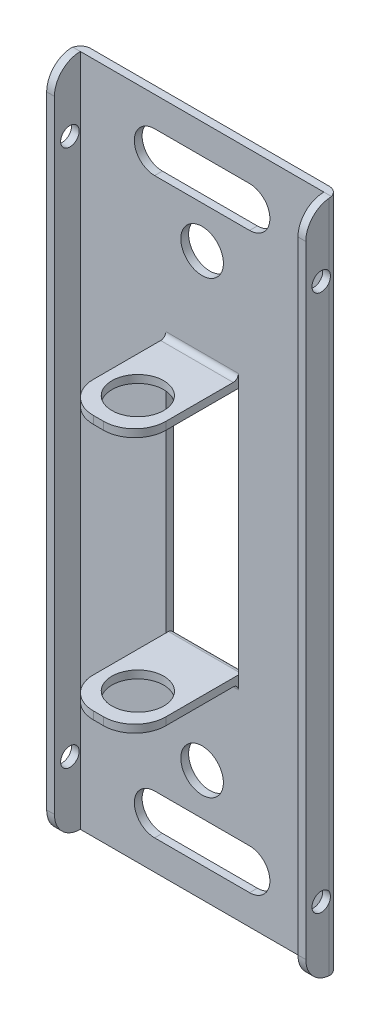
from build123d import *

# Parameters (mm, degrees)
SKETCH1_W           = 50
SKETCH1_H           = 130
SKETCH1_R           = 4.108488497
SKETCH1_W_2         = 14
SKETCH1_H_2         = 47.88
BOSS_EXTRUDE1_DEPTH = 1.5
SKETCH2_W           = 1.5
SKETCH2_H           = 130
BOSS_EXTRUDE2_DEPTH = 5
SKETCH3_R           = 1.78890387
CUT_EXTRUDE1_DEPTH  = 83.263296798
FILLET1_R           = 5
FILLET2_R           = 2
SKETCH4_W           = 14
SKETCH4_H           = 1.5
BOSS_EXTRUDE3_DEPTH = 20
FILLET3_R           = 6
FILLET4_R           = 1
SKETCH5_R           = 5
CUT_EXTRUDE2_DEPTH  = 97.263407498


with BuildPart() as part:
    # Sketch1 → Boss-Extrude1 (new body)
    with BuildSketch(Plane.XY):
        Rectangle(SKETCH1_W, SKETCH1_H)
        with Locations((0, 43.4034135)):
            Circle(SKETCH1_R, mode=Mode.SUBTRACT)
        with Locations(Location((0, -43.4034135, 0), (0, 0, 180))):
            Circle(SKETCH1_R, mode=Mode.SUBTRACT)
        Rectangle(SKETCH1_W_2, SKETCH1_H_2, mode=Mode.SUBTRACT)
        with BuildLine():
            Line((9.165030278, 51.424748184), (-9.165030278, 51.424748184))
            ThreePointArc((-9.165030278, 51.424748184), (-13.077876466, 55.337594372), (-9.165030278, 59.250440559))
            Line((-9.165030278, 59.250440559), (9.165030278, 59.250440559))
            ThreePointArc((9.165030278, 59.250440559), (13.077876466, 55.337594372), (9.165030278, 51.424748184))
        make_face(mode=Mode.SUBTRACT)
        with BuildLine():
            Line((9.165030278, -51.424748184), (-9.165030278, -51.424748184))
            ThreePointArc((-9.165030278, -51.424748184), (-13.077876466, -55.337594372), (-9.165030278, -59.250440559))
            Line((-9.165030278, -59.250440559), (9.165030278, -59.250440559))
            ThreePointArc((9.165030278, -59.250440559), (13.077876466, -55.337594372), (9.165030278, -51.424748184))
        make_face(mode=Mode.SUBTRACT)
    extrude(amount=BOSS_EXTRUDE1_DEPTH)

    # Sketch2 → Boss-Extrude2 (add)
    with BuildSketch(Plane.XY.offset(1.5)):
        with Locations((-24.25, 0)):
            Rectangle(SKETCH2_W, SKETCH2_H)
        with Locations((24.25, 0)):
            Rectangle(SKETCH2_W, SKETCH2_H)
    extrude(amount=BOSS_EXTRUDE2_DEPTH)

    # Sketch3 → Cut-Extrude1 (cut, through all)
    with BuildSketch(Plane(origin=(25, 0, 0), x_dir=(0, 0, -1), z_dir=(1, 0, 0))):
        with Locations((-3.509314499, 51.836194759)):
            Circle(SKETCH3_R)
        with Locations(Location((-3.509314499, -51.836194759, 0), (0, 0, 90))):
            Circle(SKETCH3_R)
    extrude(amount=-CUT_EXTRUDE1_DEPTH, mode=Mode.SUBTRACT)

    # Fillet1
    fillet1_edges = [part.edges().sort_by_distance(p)[0] for p in [
        (-24.25, -65, 6.5),
        (24.25, -65, 6.5),
        (24.25, 65, 6.5),
        (-24.25, 65, 6.5),
    ]]
    fillet(fillet1_edges, radius=FILLET1_R)

    # Fillet2
    # the kernel refuses this fillet: 2 mm, written as the material it takes off along each edge
    with BuildSketch(Plane(origin=(25, 70, 0), x_dir=(0, 0, 1), z_dir=(0, -1, 0))) as fillet2_piece_1:
        with BuildLine():
            CenterArc((FILLET2_R, FILLET2_R), FILLET2_R, 180, 90)
            Line((0, FILLET2_R), (0, 0))
            Line((0, 0), (FILLET2_R, 0))
        make_face()
    extrude(amount=140, mode=Mode.SUBTRACT)
    with BuildSketch(Plane(origin=(-25, -70, 0), x_dir=(1, 0, 0), z_dir=(0, 1, 0))) as fillet2_piece_2:
        with BuildLine():
            CenterArc((FILLET2_R, -FILLET2_R), FILLET2_R, 90, 90)
            Line((0, -FILLET2_R), (0, 0))
            Line((0, 0), (FILLET2_R, 0))
        make_face()
    extrude(amount=140, mode=Mode.SUBTRACT)

    # Sketch4 → Boss-Extrude3 (add)
    with BuildSketch(Plane.XY.offset(1.5)):
        with Locations((0, 24.69)):
            Rectangle(SKETCH4_W, SKETCH4_H)
        with Locations((0, -24.69)):
            Rectangle(SKETCH4_W, SKETCH4_H)
    extrude(amount=BOSS_EXTRUDE3_DEPTH)

    # Fillet3
    fillet3_edges = [part.edges().sort_by_distance(p)[0] for p in [
        (7, 24.69, 21.5),
        (-7, 24.69, 21.5),
        (-7, -24.69, 21.5),
        (7, -24.69, 21.5),
    ]]
    fillet(fillet3_edges, radius=FILLET3_R)

    # Fillet4
    fillet4_edges = [part.edges().sort_by_distance(p)[0] for p in [
        (0, -23.94, 0),
        (0, 23.94, 0),
        (0, 25.44, 1.5),
        (0, -25.44, 1.5),
    ]]
    fillet(fillet4_edges, radius=FILLET4_R)

    # Sketch5 → Cut-Extrude2 (cut, through all)
    with BuildSketch(Plane(origin=(0, 25.44, 0), x_dir=(1, 0, 0), z_dir=(0, 1, 0))):
        with Locations(Location((0, -13.904712179, 0), (0, 0, 180))):
            Circle(SKETCH5_R)
    extrude(amount=-CUT_EXTRUDE2_DEPTH, mode=Mode.SUBTRACT)


solid = part.part
